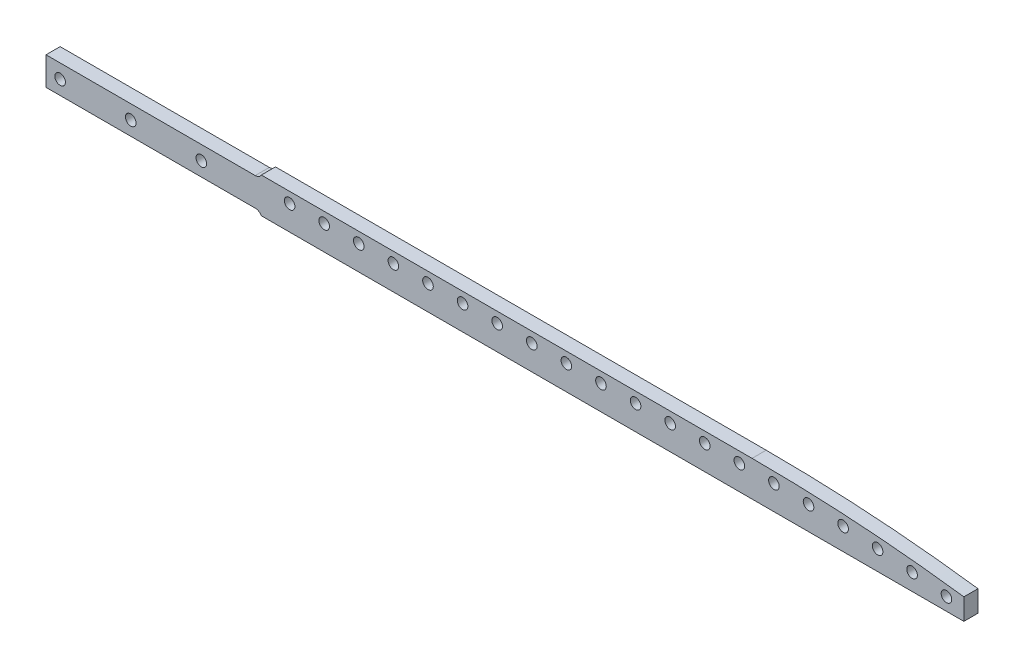
from build123d import *

# Parameters (mm, degrees)
SKETCH_1_W                = 260
SKETCH_1_H                = 10
EXTRUDE_1_DEPTH           = 4
SKETCH_2_W                = 122
SKETCH_2_H                = 2
CUT_EXTRUDE_1_DEPTH       = 4
SKETCH_4_R                = 1.5
CUT_EXTRUDE_2_DEPTH       = 4
FILLET_1_R                = 2
SKETCH_7_R                = 1.5
CUT_EXTRUDE_3_DEPTH       = 4
PATTERN_CURVE_1_OUTLINE_R = 1.5
PATTERN_CURVE_1_DEPTH     = 4
CUT_EXTRUDE_4_DEPTH       = 4


# Read off the part's stored shape, not the designer's step: 曲线阵列1
with BuildPart() as part:
    # 草图1 → 凸台-拉伸1 (new body)
    with BuildSketch(Plane.XY):
        Rectangle(SKETCH_1_W, SKETCH_1_H)
    extrude(amount=EXTRUDE_1_DEPTH)

    # 草图2 → 切除-拉伸1 (cut)
    with BuildSketch(Plane.XY.offset(4)):
        with Locations((-130, 5)):
            Rectangle(SKETCH_2_W, SKETCH_2_H)
    cut_extrude_1 = extrude(amount=-CUT_EXTRUDE_1_DEPTH, mode=Mode.SUBTRACT)

    # 镜向1: 切除-拉伸1 across plane
    add(cut_extrude_1.mirror(Plane.ZX), mode=Mode.SUBTRACT)

    # 草图4 → 切除-拉伸2 (cut)
    with BuildSketch(Plane.XY.offset(4)):
        with Locations((-126, 0)):
            Circle(SKETCH_4_R)
        with Locations((-86, 0)):
            Circle(SKETCH_4_R)
        with Locations((-106, 0)):
            Circle(SKETCH_4_R)
    extrude(amount=-CUT_EXTRUDE_2_DEPTH, mode=Mode.SUBTRACT)

    # 圆角1
    # the kernel refuses this fillet: 2 mm, written as the material it adds along each edge
    with BuildSketch(Plane(origin=(-69, -4, 4), x_dir=(0, -1, 0), z_dir=(0, 0, -1))) as fillet_1_piece_1:
        with BuildLine():
            CenterArc((2, 1.732050808), FILLET_1_R, 180, 60)
            Line((0, 1.732050808), (-0.04, 1.732050808))
            Line((-0.04, 1.732050808), (-0.04, 0))
            Line((-0.04, 0), (0, -0.04))
            ThreePointArc((0, -0.04), (0.5, -0.04), (0.98, -0.034641016))
            Line((0.98, -0.034641016), (1, 0))
        make_face()
    extrude(amount=4)
    with BuildSketch(Plane(origin=(-69, 4, 4), x_dir=(-1, 0, 0), z_dir=(0, 0, -1))) as fillet_1_piece_2:
        with BuildLine():
            CenterArc((1.732050808, 2), FILLET_1_R, 210, 60)
            Line((0, 1), (-0.034641016, 0.98))
            ThreePointArc((-0.034641016, 0.98), (-0.04, 0.5), (-0.04, 0))
            Line((-0.04, 0), (0, -0.04))
            Line((0, -0.04), (1.732050808, -0.04))
            Line((1.732050808, -0.04), (1.732050808, 0))
        make_face()
    extrude(amount=4)

    # 草图7 → 切除-拉伸3 (cut)
    with BuildSketch(Plane.XY.offset(4)):
        with Locations((-61, 2)):
            Circle(SKETCH_7_R)
    extrude(amount=-CUT_EXTRUDE_3_DEPTH, mode=Mode.SUBTRACT)

    # 曲线阵列1 outline → 曲线阵列1 (cut)
    with BuildSketch(Plane.XY):
        with Locations((125.062891226, -1.366432364)):
            Circle(PATTERN_CURVE_1_OUTLINE_R)
        with Locations((115.323700734, -0.278128004)):
            Circle(PATTERN_CURVE_1_OUTLINE_R)
        with Locations((105.563205139, 0.598777673)):
            Circle(PATTERN_CURVE_1_OUTLINE_R)
        with Locations((95.785992512, 1.263872463)):
            Circle(PATTERN_CURVE_1_OUTLINE_R)
        with Locations((85.996658783, 1.716843728)):
            Circle(PATTERN_CURVE_1_OUTLINE_R)
        with Locations((76.199805579, 1.957478543)):
            Circle(PATTERN_CURVE_1_OUTLINE_R)
        with Locations((66.4, 2)):
            Circle(PATTERN_CURVE_1_OUTLINE_R)
        with Locations((56.6, 2)):
            Circle(PATTERN_CURVE_1_OUTLINE_R)
        with Locations((46.8, 2)):
            Circle(PATTERN_CURVE_1_OUTLINE_R)
        with Locations((37, 2)):
            Circle(PATTERN_CURVE_1_OUTLINE_R)
        with Locations((27.2, 2)):
            Circle(PATTERN_CURVE_1_OUTLINE_R)
        with Locations((17.4, 2)):
            Circle(PATTERN_CURVE_1_OUTLINE_R)
        with Locations((7.6, 2)):
            Circle(PATTERN_CURVE_1_OUTLINE_R)
        with Locations((-2.2, 2)):
            Circle(PATTERN_CURVE_1_OUTLINE_R)
        with Locations((-12, 2)):
            Circle(PATTERN_CURVE_1_OUTLINE_R)
        with Locations((-21.8, 2)):
            Circle(PATTERN_CURVE_1_OUTLINE_R)
        with Locations((-31.6, 2)):
            Circle(PATTERN_CURVE_1_OUTLINE_R)
        with Locations((-41.4, 2)):
            Circle(PATTERN_CURVE_1_OUTLINE_R)
        with Locations((-51.2, 2)):
            Circle(PATTERN_CURVE_1_OUTLINE_R)
    extrude(amount=PATTERN_CURVE_1_DEPTH, mode=Mode.SUBTRACT)

    # 草图8 → 切除-拉伸4 (cut)
    with BuildSketch(Plane.XY.offset(4)):
        with BuildLine():
            Line((70, 5), (130, 5))
            Line((130, 5), (130.398230088, 0.973451327))
            ThreePointArc((130.398230088, 0.973451327), (100.266149788, 3.992246825), (70, 5))
        make_face()
    extrude(amount=-CUT_EXTRUDE_4_DEPTH, mode=Mode.SUBTRACT)


solid = part.part
